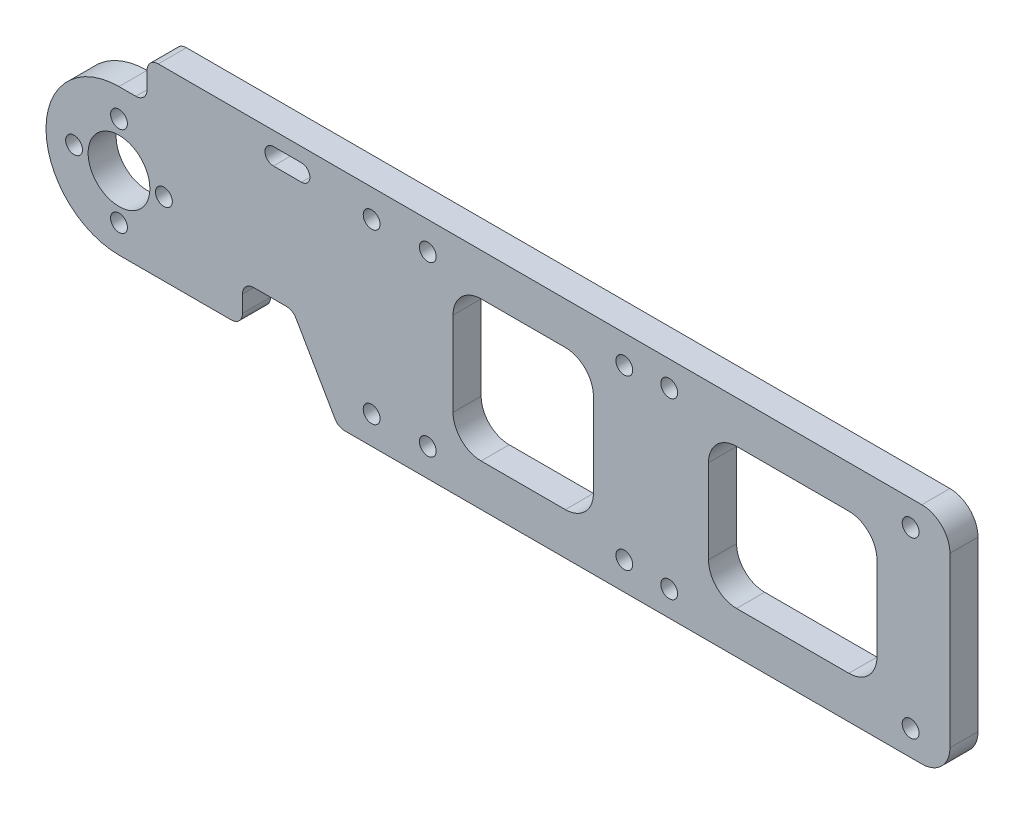
from build123d import *

# Parameters (mm, degrees)
SKETCH2_R           = 5.5
BOSS_EXTRUDE1_DEPTH = 2.5
FILLET1_R           = 5
SKETCH3_R           = 1.5
CUT_EXTRUDE1_DEPTH  = 150.428912865
FILLET2_R           = 2
SKETCH4_W           = 25
SKETCH4_H           = 25
SKETCH4_W_2         = 30
CUT_EXTRUDE2_DEPTH  = 10
FILLET3_R           = 5


with BuildPart() as part:
    # Sketch2 → Boss-Extrude1 (new, symmetric)
    with BuildSketch(Plane.XY):
        with BuildLine():
            Line((5, 13), (0, 13))
            ThreePointArc((0, 13), (-13, 0), (0, -13))
            Line((0, -13), (22, -13))
            Line((22, -13), (22, -6))
            Line((22, -6), (30.958548116, -6))
            Line((30.958548116, -6), (39.041451884, -20))
            Line((39.041451884, -20), (148, -20))
            Line((148, -20), (148, 20))
            Line((148, 20), (5, 20))
            Line((5, 20), (5, 13))
        make_face()
        Circle(SKETCH2_R, mode=Mode.SUBTRACT)
    extrude(amount=BOSS_EXTRUDE1_DEPTH, both=True)

    # Fillet1
    fillet1_edges = [part.edges().sort_by_distance(p)[0] for p in [
        (148, -20, 0),
        (148, 20, 0),
    ]]
    fillet(fillet1_edges, radius=FILLET1_R)

    # Sketch3 → Cut-Extrude1 (cut, through all)
    with BuildSketch(Plane(origin=(0, 0, -2.5), x_dir=(-1, 0, 0), z_dir=(0, 0, -1))):
        with Locations((-141, 15.5)):
            Circle(SKETCH3_R)
        with Locations((-98, 15.5)):
            Circle(SKETCH3_R)
        with Locations((-90, 15)):
            Circle(SKETCH3_R)
        with Locations((-8, 0)):
            Circle(SKETCH3_R)
        with Locations((0, 8)):
            Circle(SKETCH3_R)
        with Locations((0, -8)):
            Circle(SKETCH3_R)
        with Locations((8, 0)):
            Circle(SKETCH3_R)
        with BuildLine():
            Line((-27.5, 17.5), (-32.5, 17.5))
            ThreePointArc((-32.5, 17.5), (-34, 16), (-32.5, 14.5))
            Line((-32.5, 14.5), (-27.5, 14.5))
            ThreePointArc((-27.5, 14.5), (-26, 16), (-27.5, 17.5))
        make_face()
        with Locations((-55, -15)):
            Circle(SKETCH3_R)
        with Locations((-90, -15)):
            Circle(SKETCH3_R)
        with Locations((-45, -15)):
            Circle(SKETCH3_R)
        with Locations((-45, 15)):
            Circle(SKETCH3_R)
        with Locations((-55, 15)):
            Circle(SKETCH3_R)
        with Locations((-141, -15.5)):
            Circle(SKETCH3_R)
        with Locations((-98, -15.5)):
            Circle(SKETCH3_R)
    extrude(amount=-CUT_EXTRUDE1_DEPTH, mode=Mode.SUBTRACT)

    # Fillet2
    fillet2_edges = [part.edges().sort_by_distance(p)[0] for p in [
        (5, 20, 0),
        (5, 13, 0),
        (22, -13, 0),
        (22, -6, 0),
        (39.041451884, -20, 0),
        (30.958548116, -6, 0),
    ]]
    fillet(fillet2_edges, radius=FILLET2_R)

    # Sketch4 → Cut-Extrude2 (cut)
    with BuildSketch(Plane.XY.offset(2.5)):
        with Locations((72, 0)):
            Rectangle(SKETCH4_W, SKETCH4_H)
        with Locations((120, 0)):
            Rectangle(SKETCH4_W_2, SKETCH4_H)
    extrude(amount=-CUT_EXTRUDE2_DEPTH, mode=Mode.SUBTRACT)

    # Fillet3
    fillet3_edges = [part.edges().sort_by_distance(p)[0] for p in [
        (135, 12.5, 0),
        (105, 12.5, 0),
        (135, -12.5, 0),
        (105, -12.5, 0),
        (84.5, -12.5, 0),
        (84.5, 12.5, 0),
        (59.5, -12.5, 0),
        (59.5, 12.5, 0),
    ]]
    fillet(fillet3_edges, radius=FILLET3_R)


solid = part.part
